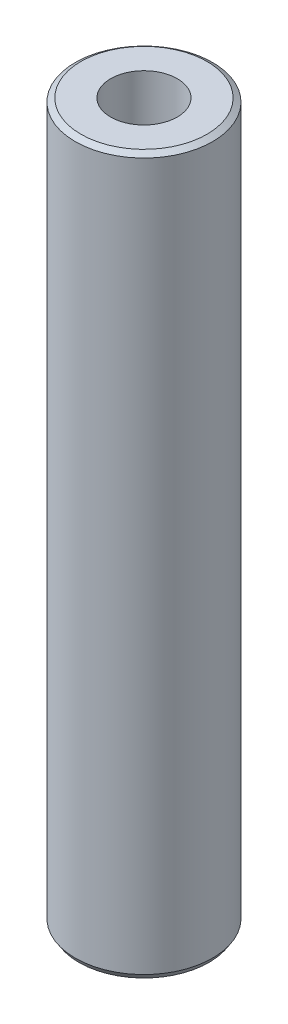
from build123d import *
from OCP.BRepFilletAPI import BRepFilletAPI_MakeChamfer

# Parameters (mm, degrees)
SKETCH1_R           = 57.5
BOSS_EXTRUDE1_DEPTH = 600
SKETCH2_R           = 27.890890658
CUT_EXTRUDE1_DEPTH  = 606.485342515
CHAMFER1_SIZE       = 3.034002383
CHAMFER1_SIZE2      = 4.668332891


with BuildPart() as part:
    # Sketch1 → Boss-Extrude1 (new body)
    with BuildSketch(Plane(origin=(0, 0, 0), x_dir=(1, 0, 0), z_dir=(0, 1, 0))):
        Circle(SKETCH1_R)
    extrude(amount=BOSS_EXTRUDE1_DEPTH)

    # Sketch2 → Cut-Extrude1 (cut, through all)
    with BuildSketch(Plane(origin=(0, 0, 0), x_dir=(1, 0, 0), z_dir=(0, 1, 0))):
        Circle(SKETCH2_R)
    extrude(amount=CUT_EXTRUDE1_DEPTH, mode=Mode.SUBTRACT)

    # Chamfer1: one chamfer whose edges measure the first distance from different faces: ONE call of the kernel's chamfer builder (chamfer() names one face for all edges)
    chamfer1_edges_1 = [part.edges().sort_by_distance(p)[0] for p in [
        (-57.5, 600, 0),
    ]]
    chamfer1_side_1 = [part.faces().sort_by_distance(p)[0] for p in [
        (-57.5, 300, 0),
    ]]
    chamfer1_edges_2 = [part.edges().sort_by_distance(p)[0] for p in [
        (-57.5, 0, 0),
    ]]
    chamfer1_side_2 = [part.faces().sort_by_distance(p)[0] for p in [
        (-55.873654403, 0, 0),
    ]]
    chamfer1 = BRepFilletAPI_MakeChamfer(part.part.solid().wrapped)
    for e in chamfer1_edges_1:
        chamfer1.Add(CHAMFER1_SIZE, CHAMFER1_SIZE2, e.wrapped, chamfer1_side_1[0].wrapped)  # the first distance lies on this face
    for e in chamfer1_edges_2:
        chamfer1.Add(CHAMFER1_SIZE, CHAMFER1_SIZE2, e.wrapped, chamfer1_side_2[0].wrapped)  # the first distance lies on this face
    add(Compound.cast(chamfer1.Shape()), mode=Mode.REPLACE)


solid = part.part
